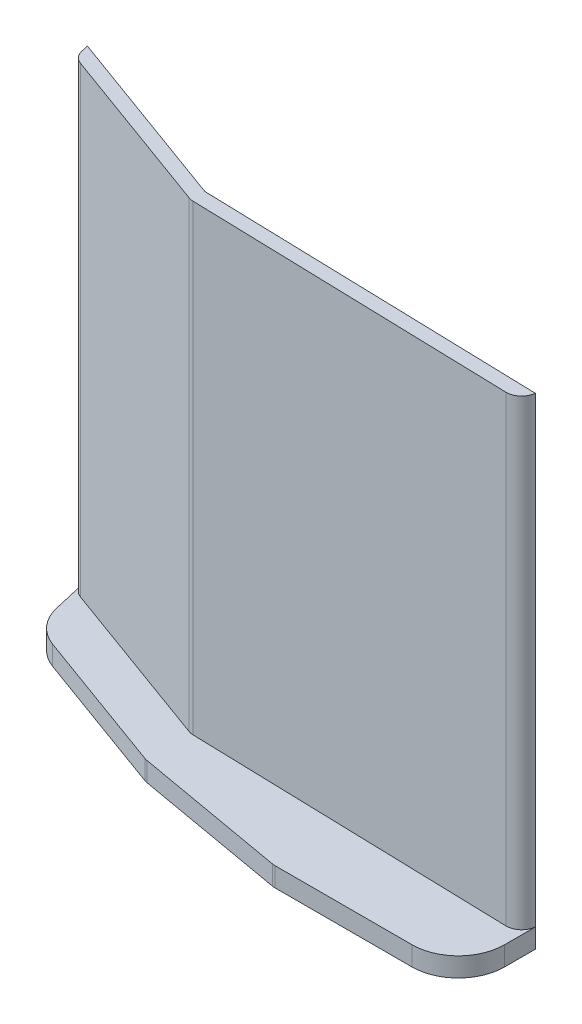
from build123d import *

# Parameters (mm, degrees)
GAGE_PLATE_SIDE_EXTRUDE_DEPTH = 3.175
BOSS_EXTRUDE2_DEPTH           = 76.2
FILLET1_R                     = 2.54
FILLET2_R                     = 7.62


with BuildPart() as part:
    # Sketch1 → Gage Plate-side Extrude (new body)
    with BuildSketch(Plane(origin=(0, 0, 0), x_dir=(1, 0, 0), z_dir=(0, 1, 0))):
        Polygon((0, 0), (0, -12.7), (-30.463396962, -12.7), (-56.042370913, -8.189736754), (-84.03796246, 1.99982526), (-86.502886868, 12.65434565), (-56.042370913, 1.567624522), align=None)
    extrude(amount=GAGE_PLATE_SIDE_EXTRUDE_DEPTH)

    # Sketch2 → Boss-Extrude2 (add)
    with BuildSketch(Plane(origin=(0, 3.175, 0), x_dir=(1, 0, 0), z_dir=(0, 1, 0))):
        Polygon((0, 0), (0, -2.344295335), (-56.042370913, -0.776670813), (-85.910666223, 10.094499628), (-86.502886868, 12.65434565), (-56.042370913, 1.567624522), align=None)
    extrude(amount=BOSS_EXTRUDE2_DEPTH)

    # Fillet1
    # the kernel refuses this fillet: 2.54 mm, written as the material it takes off along each edge
    with BuildSketch(Plane(origin=(-30.463396962, -0.555553013, 12.7), x_dir=(-0.9848077530122088, 0, -0.17364817766692622), z_dir=(0, 1, 0)), Plane(origin=(-56.042370913, -0.555553013, 8.189736754), x_dir=(-0.9396926207859081, 0, -0.3420201433256695), z_dir=(0, 1, 0))) as fillet1_piece_1:
        with BuildLine():
            CenterArc((FILLET1_R * 0.0874886635259, -FILLET1_R), FILLET1_R, 90, 10)
            Line((-FILLET1_R * 0.086159514141, -FILLET1_R * 0.0151922469878), (0, 0))
            Line((0, 0), (FILLET1_R * 0.0874886635259, 0))
        make_face()
    extrude(amount=4.286106027, mode=Mode.SUBTRACT)
    with BuildSketch(Plane(origin=(-56.042370913, 3.175, 0.776670813), x_dir=(-0.9396926207859059, 0, -0.3420201433256751), z_dir=(0, 1, 0))) as fillet1_piece_2:
        with BuildLine():
            CenterArc((FILLET1_R * 0.161944353893, -FILLET1_R), FILLET1_R, 90, 18.397732774)
            Line((-FILLET1_R * 0.153667135261, -FILLET1_R * 0.0511114986921), (0, 0))
            Line((0, 0), (FILLET1_R * 0.161944353893, 0))
        make_face()
    extrude(amount=77.228346647, mode=Mode.SUBTRACT)
    with BuildSketch(Plane(origin=(0, 3.175, 2.344295335), x_dir=(0, 0, -1), z_dir=(0, 1, 0))) as fillet1_piece_3:
        with BuildLine():
            CenterArc((2.611648042, 2.525890443), FILLET1_R, 178.397732774, 85.560295248)
            Line((0.072641158, 2.596911875), (0, 0))
            Line((0, 0), (2.344295335, 0))
        make_face()
    extrude(amount=82.694819102, mode=Mode.SUBTRACT)
    with BuildSketch(Plane(origin=(-85.910666223, 3.175, -10.094499628), x_dir=(-0.22539678463569066, 0, -0.9742670524429594), z_dir=(0, 1, 0))) as fillet1_piece_4:
        with BuildLine():
            CenterArc((FILLET1_R * 0.542659564301, -FILLET1_R), FILLET1_R, 90, 56.973788384)
            Line((-FILLET1_R * 0.295761754969, -FILLET1_R * 0.454977347815), (0, 0))
            Line((0, 0), (FILLET1_R * 0.542659564301, 0))
        make_face()
    extrude(amount=79.645888233, mode=Mode.SUBTRACT)

    # Fillet2
    fillet2_edges = [part.edges().sort_by_distance(p)[0] for p in [
        (0, 1.5875, 12.7),
        (-84.03796246, 1.5875, -1.99982526),
    ]]
    fillet(fillet2_edges, radius=FILLET2_R)


solid = part.part
